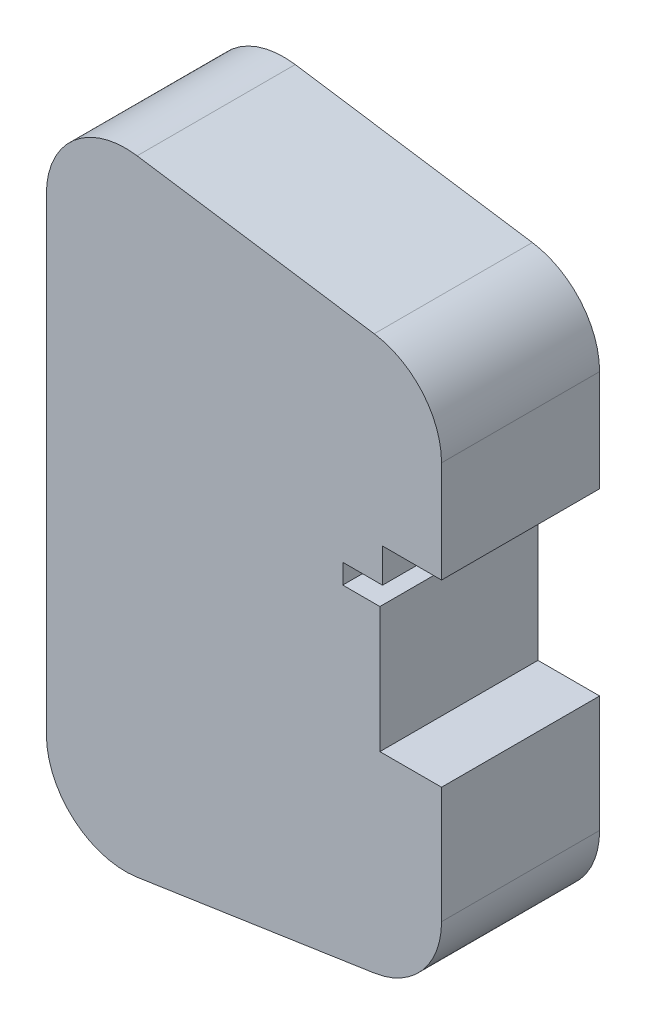
from build123d import *

# Parameters (mm, degrees)
BOSS_EXTRUDE1_DEPTH = 20
SKETCH5_W           = 9
SKETCH5_H           = 1.454272164
CUT_EXTRUDE4_DEPTH  = 10
SKETCH6_R           = 0.5
CUT_EXTRUDE5_DEPTH  = 5
CUT_EXTRUDE6_DEPTH  = 67.866890284
SKETCH11_R          = 1
CUT_EXTRUDE7_DEPTH  = 5


with BuildPart() as part:
    # Sketch1 → Boss-Extrude1 (new body)
    with BuildSketch(Plane.XY):
        with BuildLine():
            Line((0, 29.638125792), (0, -29.638125792))
            ThreePointArc((0, -29.638125792), (3.474436626, -37.215527896), (11.483404529, -39.527489321))
            Line((11.483404529, -39.527489321), (41.483404529, -35.027489321))
            ThreePointArc((41.483404529, -35.027489321), (47.577402104, -31.663689166), (50, -25.138125792))
            Line((50, -25.138125792), (50, 25.138125792))
            ThreePointArc((50, 25.138125792), (47.577402104, 31.663689166), (41.483404529, 35.027489321))
            Line((41.483404529, 35.027489321), (11.483404529, 39.527489321))
            ThreePointArc((11.483404529, 39.527489321), (3.474436626, 37.215527896), (0, 29.638125792))
        make_face()
    extrude(amount=BOSS_EXTRUDE1_DEPTH)

    # Sketch5 → Cut-Extrude4 (cut)
    with BuildSketch(Plane.ZY):
        with Locations((10, 16.569972364)):
            Rectangle(SKETCH5_W, SKETCH5_H)
    extrude(amount=-CUT_EXTRUDE4_DEPTH, mode=Mode.SUBTRACT)

    # Sketch6 → Cut-Extrude5 (cut)
    with BuildSketch(Plane.XZ.offset(-17.297108446)):
        with Locations((2.644871575, 10)):
            Circle(SKETCH6_R)
    extrude(amount=-CUT_EXTRUDE5_DEPTH, mode=Mode.SUBTRACT)

    # Sketch9 → Cut-Extrude6 (cut, through all)
    with BuildSketch(Plane.XY.offset(20)):
        Polygon((42.2, 5.497108446), (42.2, -10.402891554), (50, -10.402891554), (50, 12.297108446), (42.53, 12.297108446), (42.53, 7.997108446), (37.5, 7.997108446), (37.5, 5.497108446), align=None)
    extrude(amount=-CUT_EXTRUDE6_DEPTH, mode=Mode.SUBTRACT)

    # Sketch11 → Cut-Extrude7 (cut)
    with BuildSketch(Plane(origin=(0, 7.997108446, 0), x_dir=(-1, 0, 0), z_dir=(0, -1, 0))):
        with Locations((-40.23, -10)):
            Circle(SKETCH11_R)
    extrude(amount=-CUT_EXTRUDE7_DEPTH, mode=Mode.SUBTRACT)


solid = part.part
